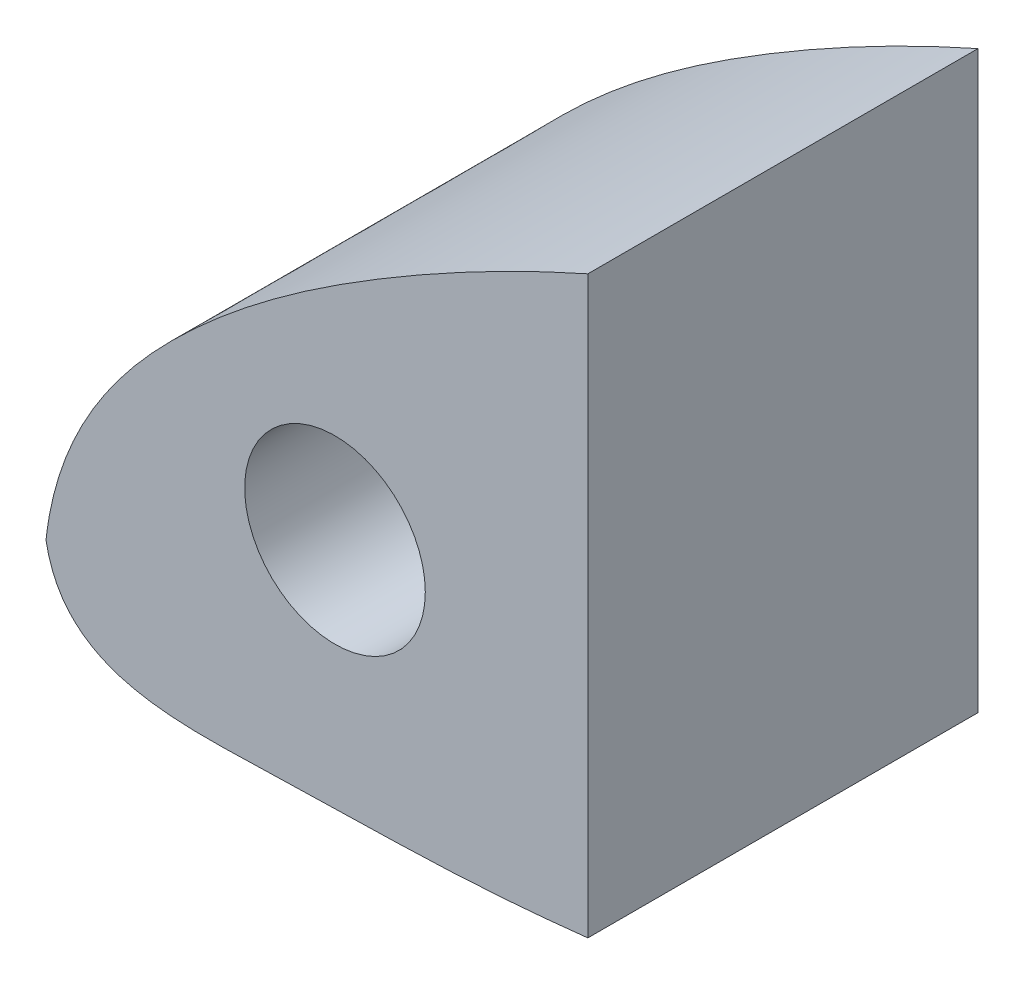
from build123d import *

# Parameters (mm, degrees)
BOSS_EXTRUDE1_DEPTH = 27.432
SKETCH2_R           = 6.35
SKETCH2_R_2         = 3.175
CUT_EXTRUDE1_DEPTH  = 317.917465392
SKETCH3_W           = 293.188888759
SKETCH3_H           = 137.971241769
CUT_EXTRUDE2_DEPTH  = 317.917465392


with BuildPart() as part:
    # Sketch1 → Boss-Extrude1 (new body)
    with BuildSketch(Plane.XY):
        with BuildLine():
            add(Edge.make_bspline(
                [(0.000560351, 0.000130087), (0.810633127, 7.359196055), (8.649092025, 17.856605174), (26.286719818, 29.975176328), (52.111128271, 42.069215275), (89.597618475, 49.290763054), (131.400792109, 47.884831915), (173.256699242, 40.041104278), (217.961060472, 29.612974894), (256.952064401, 19.528920948), (290.35983767, 8.71099439), (301.273197721, 4.382828139), (314.816918223, -0.516206742), (309.846313895, 0.000130087)],
                knots=[0, 0, 0, 0, 0.060863618, 0.113688265, 0.188608742, 0.312908923, 0.448482434, 0.557612135, 0.691544113, 0.852438279, 0.92975597, 0.976058229, 1, 1, 1, 1], degree=3))
            add(Edge.make_bspline(
                [(309.846313895, 0.000130087), (303.956832565, 1.47095521), (293.989507544, 2.093987313), (276.26402299, 4.514356704), (260.846344817, 5.427413394), (235.858814759, 7.870306192), (205.101424636, 8.838080282), (157.718638092, 9.030650149), (110.497331172, 6.181495223), (66.506197185, -0.586669107), (36.454672816, -6.098499901), (15.316603331, -6.189065841), (1.230714189, -6.924076091), (0.000560351, 0.000130087)],
                knots=[0, 0, 0, 0, 0.057787081, 0.095274891, 0.171021118, 0.205339302, 0.335319146, 0.464904334, 0.658702312, 0.785511947, 0.893517288, 0.94309214, 1, 1, 1, 1], degree=3))
        make_face()
    extrude(amount=BOSS_EXTRUDE1_DEPTH)

    # Sketch2 → Cut-Extrude1 (cut, through all)
    with BuildSketch(Plane.XY.offset(27.432)):
        with Locations((20.32, 10.16)):
            Circle(SKETCH2_R)
        with Locations((227.296313895, 19.050130087)):
            Circle(SKETCH2_R_2)
    extrude(amount=-CUT_EXTRUDE1_DEPTH, mode=Mode.SUBTRACT)

    # Sketch3 → Cut-Extrude2 (cut, through all)
    with BuildSketch(Plane.XY.offset(27.432)):
        with Locations((184.69444438, 2.732377951)):
            Rectangle(SKETCH3_W, SKETCH3_H)
    extrude(amount=-CUT_EXTRUDE2_DEPTH, mode=Mode.SUBTRACT)


solid = part.part
